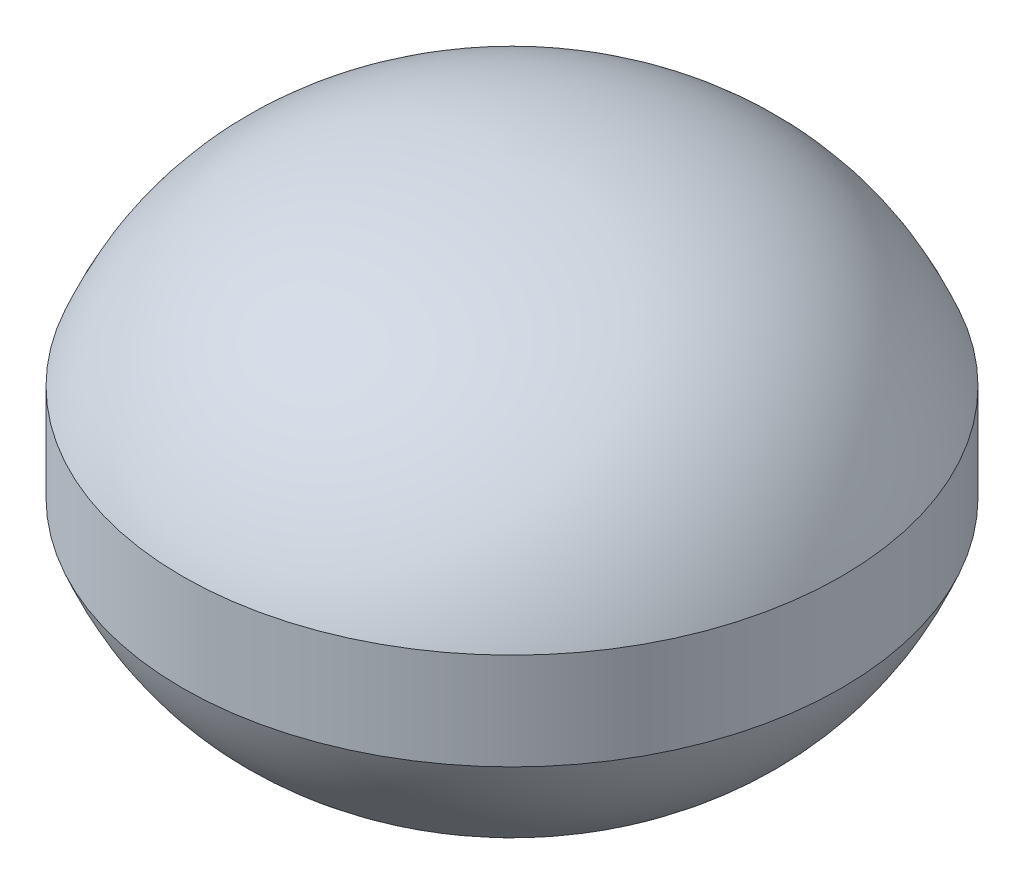
from build123d import *

# Parameters (mm, degrees)
SKETCH4_R           = 450.85
BOSS_EXTRUDE2_DEPTH = 66.2


with BuildPart() as part:
    # Sketch4 → Boss-Extrude2 (new, symmetric)
    with BuildSketch(Plane(origin=(0, 0, 0), x_dir=(1, 0, 0), z_dir=(0, 1, 0))):
        Circle(SKETCH4_R)
    extrude(amount=BOSS_EXTRUDE2_DEPTH, both=True)

    # Sketch10 → Revolve7 (revolve)
    with BuildSketch(Plane.XY):
        with BuildLine():
            Line((-450.85, 66.2), (0, 66.2))
            Line((0, 66.2), (0, 336.55))
            add(Edge.make_bspline(
                [(-450.85, 66.2), (-347.711285852, 328.659338565), (0, 336.55)],
                knots=[0, 0, 0, 1, 1, 1], degree=2))
        make_face()
        with BuildLine():
            Line((-450.85, -66.2), (0, -66.2))
            Line((0, -66.2), (0, -336.55))
            add(Edge.make_bspline(
                [(-450.85, -66.2), (-347.711285852, -328.659338565), (0, -336.55)],
                knots=[0, 0, 0, 1, 1, 1], degree=2))
        make_face()
    revolve(axis=Axis((0, 0, 0), (0, 1, 0)))


solid = part.part
